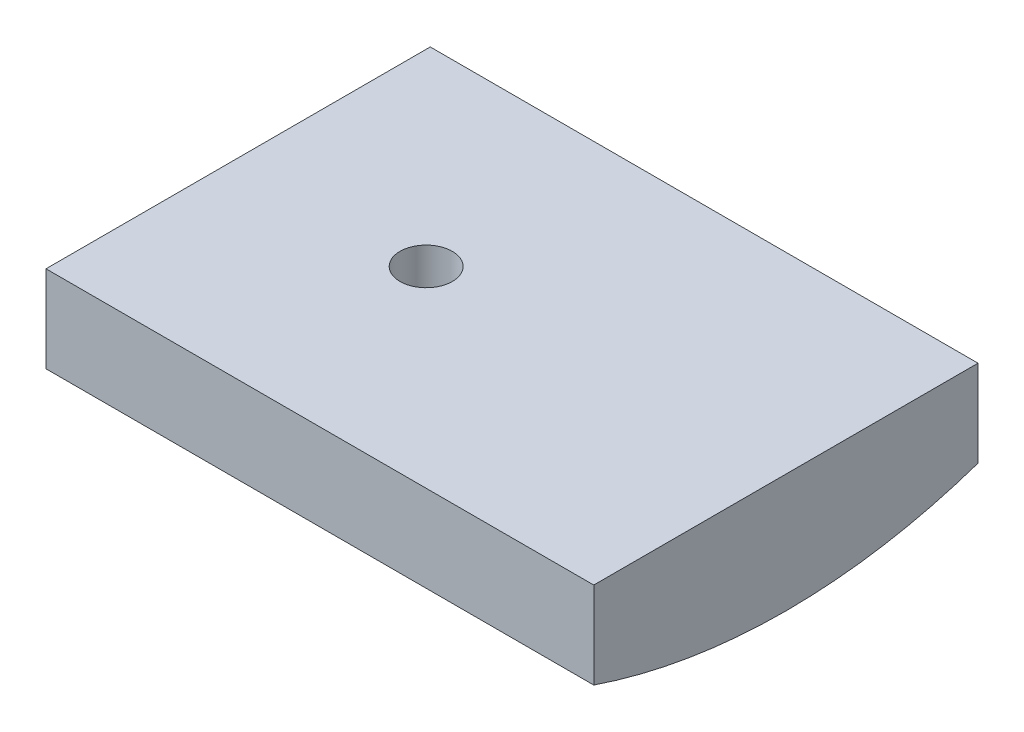
from build123d import *

# Parameters (mm, degrees)
BOSS_EXTRUDE1_DEPTH = 67
SKETCH2_R           = 3.2
CUT_EXTRUDE1_DEPTH  = 73.467233975


with BuildPart() as part:
    # Sketch1 → Boss-Extrude1 (new body)
    with BuildSketch(Plane(origin=(0, 0, 0), x_dir=(0, 0, -1), z_dir=(1, 0, 0))):
        with BuildLine():
            Line((-23.5, -58.2), (23.5, -58.2))
            Line((23.5, -58.2), (23.5, -68.797092962))
            ThreePointArc((23.5, -68.797092962), (0, -72.7), (-23.5, -68.797092962))
            Line((-23.5, -68.797092962), (-23.5, -58.2))
        make_face()
    extrude(amount=BOSS_EXTRUDE1_DEPTH)

    # Sketch2 → Cut-Extrude1 (cut, through all)
    with BuildSketch(Plane(origin=(0, -58.2, 0), x_dir=(1, 0, 0), z_dir=(0, 1, 0))):
        with Locations((23, 0)):
            Circle(SKETCH2_R)
    extrude(amount=-CUT_EXTRUDE1_DEPTH, mode=Mode.SUBTRACT)


solid = part.part
